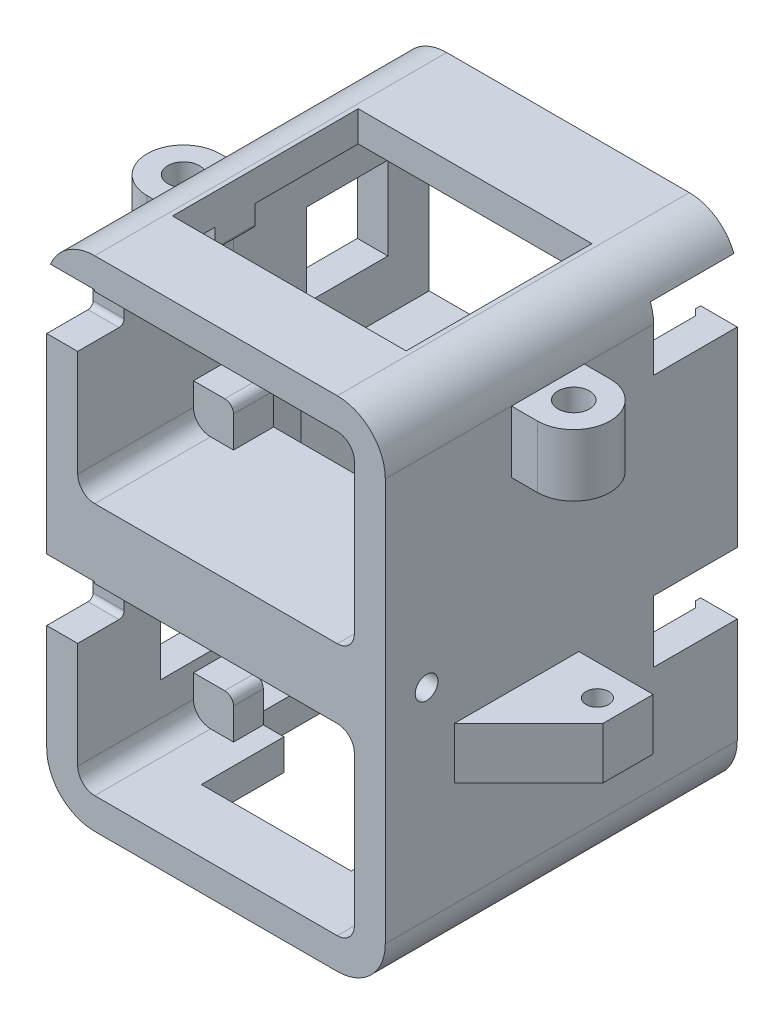
from build123d import *

# Parameters (mm, degrees)
EXTRUDE_2_DEPTH      = 11.22
EXTRUDE_3_DEPTH      = 3.88
CUT_EXTRUDE_1_DEPTH  = 4.65
SKETCH_8_R           = 3.525
SKETCH_8_R_2         = 1.525
EXTRUDE_5_DEPTH      = 6
SKETCH_9_W           = 22.64
SKETCH_9_H           = 3
CUT_EXTRUDE_3_DEPTH  = 8
SKETCH_10_W          = 21.46
SKETCH_10_H          = 6.88
CUT_EXTRUDE_4_DEPTH  = 1
SKETCH_12_R          = 1.1
CUT_EXTRUDE_5_DEPTH  = 8
CUT_EXTRUDE_START    = -8
SKETCH_13_R          = 1.1
CUT_EXTRUDE_6_DEPTH  = 8
SKETCH_14_W          = 6.52
SKETCH_14_H          = 9.68
EXTRUDE_7_DEPTH      = 3
SKETCH_15_W          = 26.9
SKETCH_15_H          = 42.4
EXTRUDE_8_DEPTH      = 19
SKETCH_16_W          = 26.9
SKETCH_16_H          = 6.6
EXTRUDE_9_DEPTH      = 16
EXTRUDE_6_DEPTH      = 5
CUT_EXTRUDE_8_REACH  = 51.73
CUT_EXTRUDE_9_REACH  = 63.439
SKETCH_18_W          = 8.1
SKETCH_18_H          = 6
CUT_EXTRUDE_START_2  = -2.95
SKETCH_19_W          = 21.46
SKETCH_19_H          = 1
SKETCH_19_H_2        = 10
CUT_EXTRUDE_10_DEPTH = 2.95
CUT_EXTRUDE_14_REACH = 65.659
SKETCH_24_W          = 14
SKETCH_24_H          = 8
CUT_EXTRUDE_11_REACH = 65.659
SKETCH_20_W          = 22.64
SKETCH_20_H          = 10
SKETCH_21_W          = 1.5
SKETCH_21_H          = 5
EXTRUDE_10_DEPTH     = 0.6
CHAMFER_1_SIZE       = 1
CUT_EXTRUDE_12_REACH = 65.933
SKETCH_22_W          = 15
SKETCH_22_H          = 9.84
SKETCH_22_W_2        = 7.1
SKETCH_22_W_3        = 7.859919518
SKETCH_22_H_2        = 8.04
CUT_EXTRUDE_13_REACH = 65.659
SKETCH_23_W          = 0.52
SKETCH_23_H          = 8


with BuildPart() as part:
    # 草图2 → 凸台-拉伸2 (new body)
    with BuildSketch(Plane.XY):
        with BuildLine():
            ThreePointArc((-16.4, -7.25), (-15.038046533, -10.538046533), (-11.75, -11.9))
            Line((-11.75, -11.9), (11.75, -11.9))
            ThreePointArc((11.75, -11.9), (15.038046533, -10.538046533), (16.4, -7.25))
            Line((16.4, -7.25), (16.4, 31.75))
            ThreePointArc((16.4, 31.75), (15.038046533, 35.038046533), (11.75, 36.4))
            Line((11.75, 36.4), (-11.75, 36.4))
            ThreePointArc((-11.75, 36.4), (-15.038046533, 35.038046533), (-16.4, 31.75))
            Line((-16.4, 31.75), (-16.4, -7.25))
        make_face()
        with BuildLine():
            Line((13.4, 7.25), (13.4, -7.25))
            ThreePointArc((13.4, -7.25), (12.916726189, -8.416726189), (11.75, -8.9))
            Line((11.75, -8.9), (-11.75, -8.9))
            ThreePointArc((-11.75, -8.9), (-12.916726189, -8.416726189), (-13.4, -7.25))
            Line((-13.4, -7.25), (-13.4, 7.25))
            ThreePointArc((-13.4, 7.25), (-12.916726189, 8.416726189), (-11.75, 8.9))
            Line((-11.75, 8.9), (11.75, 8.9))
            ThreePointArc((11.75, 8.9), (12.916726189, 8.416726189), (13.4, 7.25))
        make_face(mode=Mode.SUBTRACT)
        with BuildLine():
            Line((-11.75, 33.4), (11.75, 33.4))
            ThreePointArc((11.75, 33.4), (12.916726189, 32.916726189), (13.4, 31.75))
            Line((13.4, 31.75), (13.4, 17.25))
            ThreePointArc((13.4, 17.25), (12.916726189, 16.083273811), (11.75, 15.6))
            Line((11.75, 15.6), (-11.75, 15.6))
            ThreePointArc((-11.75, 15.6), (-12.916726189, 16.083273811), (-13.4, 17.25))
            Line((-13.4, 17.25), (-13.4, 31.75))
            ThreePointArc((-13.4, 31.75), (-12.916726189, 32.916726189), (-11.75, 33.4))
        make_face(mode=Mode.SUBTRACT)
    extrude(amount=-EXTRUDE_2_DEPTH)

    # 草图3 → 凸台-拉伸3 (add)
    with BuildSketch(Plane(origin=(0, 0, -11.22), x_dir=(-1, 0, 0), z_dir=(0, 0, -1))):
        with BuildLine():
            ThreePointArc((11.75, -11.9), (15.038046533, -10.538046533), (16.4, -7.25))
            Line((16.4, -7.25), (16.4, 31.75))
            ThreePointArc((16.4, 31.75), (15.038046533, 35.038046533), (11.75, 36.4))
            Line((11.75, 36.4), (-11.75, 36.4))
            ThreePointArc((-11.75, 36.4), (-15.038046533, 35.038046533), (-16.4, 31.75))
            Line((-16.4, 31.75), (-16.4, -7.25))
            ThreePointArc((-16.4, -7.25), (-15.038046533, -10.538046533), (-11.75, -11.9))
            Line((-11.75, -11.9), (11.75, -11.9))
        make_face()
        with BuildLine():
            Line((13.4, -5.02), (10.37, -5.02))
            ThreePointArc((10.37, -5.02), (9.768959236, -5.268959236), (9.52, -5.87))
            Line((9.52, -5.87), (9.52, -8.9))
            Line((9.52, -8.9), (-9.52, -8.9))
            Line((-9.52, -8.9), (-9.52, -5.87))
            ThreePointArc((-9.52, -5.87), (-9.768959236, -5.268959236), (-10.37, -5.02))
            Line((-10.37, -5.02), (-13.4, -5.02))
            Line((-13.4, -5.02), (-13.4, 6.82))
            Line((-13.4, 6.82), (-11.67, 6.82))
            ThreePointArc((-11.67, 6.82), (-11.422512627, 6.922512627), (-11.32, 7.17))
            Line((-11.32, 7.17), (-11.32, 8.9))
            Line((-11.32, 8.9), (11.32, 8.9))
            Line((11.32, 8.9), (11.32, 7.17))
            ThreePointArc((11.32, 7.17), (11.422512627, 6.922512627), (11.67, 6.82))
            Line((11.67, 6.82), (13.4, 6.82))
            Line((13.4, 6.82), (13.4, -5.02))
        make_face(mode=Mode.SUBTRACT)
        with BuildLine():
            Line((13.4, 31.32), (13.4, 19.48))
            Line((13.4, 19.48), (10.37, 19.48))
            ThreePointArc((10.37, 19.48), (9.768959236, 19.231040764), (9.52, 18.63))
            Line((9.52, 18.63), (9.52, 15.6))
            Line((9.52, 15.6), (-9.52, 15.6))
            Line((-9.52, 15.6), (-9.52, 18.63))
            ThreePointArc((-9.52, 18.63), (-9.768959236, 19.231040764), (-10.37, 19.48))
            Line((-10.37, 19.48), (-13.4, 19.48))
            Line((-13.4, 19.48), (-13.4, 31.32))
            Line((-13.4, 31.32), (-11.67, 31.32))
            ThreePointArc((-11.67, 31.32), (-11.422512627, 31.422512627), (-11.32, 31.67))
            Line((-11.32, 31.67), (-11.32, 33.4))
            Line((-11.32, 33.4), (11.32, 33.4))
            Line((11.32, 33.4), (11.32, 31.67))
            ThreePointArc((11.32, 31.67), (11.422512627, 31.422512627), (11.67, 31.32))
            Line((11.67, 31.32), (13.4, 31.32))
        make_face(mode=Mode.SUBTRACT)
    extrude(amount=EXTRUDE_3_DEPTH)

    # 草图4 → 切除-拉伸1 (cut)
    with BuildSketch(Plane.ZY.offset(16.4)):
        with BuildLine():
            Line((0.3, 9.05), (-4, 9.05))
            ThreePointArc((-4, 9.05), (-4.353553391, 8.903553391), (-4.5, 8.55))
            Line((-4.5, 8.55), (-4.5, 3.55))
            ThreePointArc((-4.5, 3.55), (-4.353553391, 3.196446609), (-4, 3.05))
            Line((-4, 3.05), (0.3, 3.05))
            Line((0.3, 3.05), (0.3, 9.05))
        make_face()
        with BuildLine():
            Line((0.3, 33.55), (-4, 33.55))
            ThreePointArc((-4, 33.55), (-4.353553391, 33.403553391), (-4.5, 33.05))
            Line((-4.5, 33.05), (-4.5, 28.05))
            ThreePointArc((-4.5, 28.05), (-4.353553391, 27.696446609), (-4, 27.55))
            Line((-4, 27.55), (0.3, 27.55))
            Line((0.3, 27.55), (0.3, 33.55))
        make_face()
    extrude(amount=-CUT_EXTRUDE_1_DEPTH, mode=Mode.SUBTRACT)

    # 草图8 → 凸台-拉伸5 (add)
    # profile 1 of 3: a face of its own
    with BuildSketch(Plane(origin=(0, 31.75, 0), x_dir=(1, 0, 0), z_dir=(0, 1, 0))):
        with Locations((18.9, 15.755)):
            Circle(SKETCH_8_R)
        with Locations(Location((18.9, 15.755, 0), (0, 0, 270))):
            Circle(SKETCH_8_R_2, mode=Mode.SUBTRACT)
    # profile 2 of 3: a face of its own
    with BuildSketch(Plane(origin=(0, 31.75, 0), x_dir=(1, 0, 0), z_dir=(0, 1, 0))):
        with BuildLine():
            Line((15.375, 19.28), (15.375, 15.755))
            ThreePointArc((15.375, 15.755), (16.407448596, 18.247551404), (18.9, 19.28))
            Line((18.9, 19.28), (15.375, 19.28))
        make_face()
    # profile 3 of 3: a face of its own
    with BuildSketch(Plane(origin=(0, 31.75, 0), x_dir=(1, 0, 0), z_dir=(0, 1, 0))):
        with BuildLine():
            Line((15.375, 12.23), (18.9, 12.23))
            ThreePointArc((18.9, 12.23), (16.407448596, 13.262448596), (15.375, 15.755))
            Line((15.375, 15.755), (15.375, 12.23))
        make_face()
    extrude_5 = extrude(amount=-EXTRUDE_5_DEPTH)

    # 镜向1: 凸台-拉伸5 across plane
    add(extrude_5.mirror(Plane(origin=(0, 0, 0), x_dir=(0, 0, 1), z_dir=(1, 0, 0))))

    # 草图9 → 切除-拉伸3 (cut)
    with BuildSketch(Plane(origin=(0, 0, -15.1), x_dir=(-1, 0, 0), z_dir=(0, 0, -1))):
        with Locations((0, 34.9)):
            Rectangle(SKETCH_9_W, SKETCH_9_H)
    extrude(amount=-CUT_EXTRUDE_3_DEPTH, mode=Mode.SUBTRACT)

    # 草图10 → 切除-拉伸4 (cut)
    with BuildSketch(Plane(origin=(0, 0, -15.1), x_dir=(-1, 0, 0), z_dir=(0, 0, -1))):
        with Locations((0, -8.46)):
            Rectangle(SKETCH_10_W, SKETCH_10_H)
    extrude(amount=-CUT_EXTRUDE_4_DEPTH, mode=Mode.SUBTRACT)

    # 草图12 → 切除-拉伸5 (cut)
    with BuildSketch(Plane.ZY.offset(16.4)):
        with Locations((-4, 12.25)):
            Circle(SKETCH_12_R)
    extrude(amount=-CUT_EXTRUDE_5_DEPTH, mode=Mode.SUBTRACT)

    # 草图13 → 切除-拉伸6 (cut)
    with BuildSketch(Plane(origin=(16.4, 0, 0), x_dir=(0, 0, -1), z_dir=(1, 0, 0)).offset(CUT_EXTRUDE_START)):
        with Locations(Location((4, 12.25, 0), (0, 0, 180))):
            Circle(SKETCH_13_R)
    extrude(amount=CUT_EXTRUDE_6_DEPTH, mode=Mode.SUBTRACT)

    # 草图14 → 凸台-拉伸7 (add)
    with BuildSketch(Plane(origin=(0, 0, -15.1), x_dir=(-1, 0, 0), z_dir=(0, 0, -1))):
        with Locations((-13.14, 13.79)):
            Rectangle(SKETCH_14_W, SKETCH_14_H)
        with Locations((13.14, 13.79)):
            Rectangle(SKETCH_14_W, SKETCH_14_H)
    extrude(amount=EXTRUDE_7_DEPTH)

    # 草图15 → 凸台-拉伸8 (add)
    with BuildSketch(Plane(origin=(0, 0, -15.1), x_dir=(-1, 0, 0), z_dir=(0, 0, -1))):
        with BuildLine():
            Line((-16.4, 18.63), (-16.4, 8.95))
            Line((-16.4, 8.95), (-16.4, -7.25))
            ThreePointArc((-16.4, -7.25), (-15.038046533, -10.538046533), (-11.75, -11.9))
            Line((-11.75, -11.9), (11.75, -11.9))
            ThreePointArc((11.75, -11.9), (15.038046533, -10.538046533), (16.4, -7.25))
            Line((16.4, -7.25), (16.4, 8.95))
            Line((16.4, 8.95), (16.4, 18.63))
            Line((16.4, 18.63), (16.4, 31.75))
            ThreePointArc((16.4, 31.75), (15.038046533, 35.038046533), (11.75, 36.4))
            Line((11.75, 36.4), (-11.75, 36.4))
            ThreePointArc((-11.75, 36.4), (-15.038046533, 35.038046533), (-16.4, 31.75))
            Line((-16.4, 31.75), (-16.4, 25.75))
            Line((-16.4, 25.75), (-16.4, 18.63))
        make_face()
        with Locations((0, 12.25)):
            Rectangle(SKETCH_15_W, SKETCH_15_H, mode=Mode.SUBTRACT)
    extrude(amount=EXTRUDE_8_DEPTH)

    # 草图16 → 凸台-拉伸9 (add)
    with BuildSketch(Plane(origin=(0, 0, -18.1), x_dir=(-1, 0, 0), z_dir=(0, 0, -1))):
        with Locations((0, 12.25)):
            Rectangle(SKETCH_16_W, SKETCH_16_H)
    extrude(amount=EXTRUDE_9_DEPTH)

    # 草图11 → 凸台-拉伸6 (add)
    with BuildSketch(Plane(origin=(0, 2.890336251, 0), x_dir=(1, 0, 0), z_dir=(0, 1, 0))):
        with BuildLine():
            Line((18.895757056, 18.755), (16.4, 18.755))
            Line((16.4, 18.755), (16.4, 6.716602257))
            Line((16.4, 6.716602257), (19.538397743, 9.855))
            Line((19.538397743, 9.855), (18.895757056, 9.855))
            Line((18.895757056, 9.855), (18.895757056, 15.105))
            Line((18.895757056, 15.105), (20.308345089, 15.105))
            ThreePointArc((20.308345089, 15.105), (20.095757056, 15.755), (20.308345089, 16.405))
            Line((20.308345089, 16.405), (18.895757056, 16.405))
            Line((18.895757056, 16.405), (18.895757056, 18.755))
        make_face()
        with BuildLine():
            Line((23.595757056, 18.755), (18.895757056, 18.755))
            Line((18.895757056, 18.755), (18.895757056, 16.405))
            Line((18.895757056, 16.405), (20.308345089, 16.405))
            ThreePointArc((20.308345089, 16.405), (21.537697721, 16.800503028), (22.295757056, 15.755))
            ThreePointArc((22.295757056, 15.755), (21.537697721, 14.709496972), (20.308345089, 15.105))
            Line((20.308345089, 15.105), (18.895757056, 15.105))
            Line((18.895757056, 15.105), (18.895757056, 9.855))
            Line((18.895757056, 9.855), (19.538397743, 9.855))
            Line((19.538397743, 9.855), (23.595757056, 13.912359313))
            Line((23.595757056, 13.912359313), (23.595757056, 18.755))
        make_face()
    extrude(amount=EXTRUDE_6_DEPTH)

    # 草图17 → 切除-拉伸8 (cut, up to next)
    with BuildSketch(Plane.XZ.offset(-8.95), mode=Mode.PRIVATE) as cut_extrude_8_sk1:
        Polygon((-9.88, -18.1), (0, -27.98), (9.88, -18.1), align=None)
    cut_extrude_8_tool1 = extrude(cut_extrude_8_sk1.sketch, amount=-CUT_EXTRUDE_8_REACH, mode=Mode.PRIVATE) & part.part
    add(cut_extrude_8_tool1.solids().sort_by_distance((0, 8.95, -21.393333))[0], mode=Mode.SUBTRACT)

    # 草图18 → 切除-拉伸9 (cut, up to next)
    with BuildSketch(Plane.ZY.offset(-13.45), mode=Mode.PRIVATE) as cut_extrude_9_sk1:
        with Locations((-30.05, 5.95)):
            Rectangle(SKETCH_18_W, SKETCH_18_H)
    cut_extrude_9_tool1 = extrude(cut_extrude_9_sk1.sketch, amount=-CUT_EXTRUDE_9_REACH, mode=Mode.PRIVATE) & part.part
    # 草图18 → 切除-拉伸9 (cut, up to next)
    with BuildSketch(Plane.ZY.offset(-13.45), mode=Mode.PRIVATE) as cut_extrude_9_sk2:
        with Locations((-30.05, 30.45)):
            Rectangle(SKETCH_18_W, SKETCH_18_H)
    cut_extrude_9_tool2 = extrude(cut_extrude_9_sk2.sketch, amount=-CUT_EXTRUDE_9_REACH, mode=Mode.PRIVATE) & part.part
    add(cut_extrude_9_tool1.solids().sort_by_distance((13.45, 5.95, -30.05))[0], mode=Mode.SUBTRACT)
    add(cut_extrude_9_tool2.solids().sort_by_distance((13.45, 30.45, -30.05))[0], mode=Mode.SUBTRACT)

    # 草图19 → 切除-拉伸10 (cut)
    with BuildSketch(Plane.XZ.offset(11.9).offset(CUT_EXTRUDE_START_2)):
        with Locations((0, -14.6)):
            Rectangle(SKETCH_19_W, SKETCH_19_H)
        with Locations((0, -20.1)):
            Rectangle(SKETCH_19_W, SKETCH_19_H_2)
    extrude(amount=CUT_EXTRUDE_10_DEPTH, mode=Mode.SUBTRACT)

    # 草图24 → 切除-拉伸14 (cut, up to next)
    with BuildSketch(Plane.XZ.offset(11.9), mode=Mode.PRIVATE) as cut_extrude_14_sk1:
        with Locations((0, -10.1)):
            Rectangle(SKETCH_24_W, SKETCH_24_H)
    cut_extrude_14_tool1 = extrude(cut_extrude_14_sk1.sketch, amount=-CUT_EXTRUDE_14_REACH, mode=Mode.PRIVATE) & part.part
    add(cut_extrude_14_tool1.solids().sort_by_distance((0, -11.9, -10.1))[0], mode=Mode.SUBTRACT)

    # 草图20 → 切除-拉伸11 (cut, up to next)
    with BuildSketch(Plane(origin=(0, 36.4, 0), x_dir=(1, 0, 0), z_dir=(0, 1, 0)), mode=Mode.PRIVATE) as cut_extrude_11_sk1:
        with Locations((0, 20.1)):
            Rectangle(SKETCH_20_W, SKETCH_20_H)
    cut_extrude_11_tool1 = extrude(cut_extrude_11_sk1.sketch, amount=-CUT_EXTRUDE_11_REACH, mode=Mode.PRIVATE) & part.part
    add(cut_extrude_11_tool1.solids().sort_by_distance((0, 36.4, -20.1))[0], mode=Mode.SUBTRACT)

    # 草图21 → 凸台-拉伸10 (add)
    with BuildSketch(Plane.ZY.offset(-13.45)):
        with Locations((-33.35, 24.95)):
            Rectangle(SKETCH_21_W, SKETCH_21_H)
        with Locations((-33.35, 0.45)):
            Rectangle(SKETCH_21_W, SKETCH_21_H)
    extrude(amount=EXTRUDE_10_DEPTH)

    # 倒角1
    # the kernel refuses this chamfer: 1 mm, written as the material it takes off along each edge
    with BuildSketch(Plane(origin=(12.85, 5.521682988, -32.6), x_dir=(-0.02749587661058555, 0, -0.9996219169112968), z_dir=(0, -1, 0))) as chamfer_1_piece_1_section:
        Polygon((CHAMFER_1_SIZE * 0.999621916911, CHAMFER_1_SIZE * 0.0274958766106), (-CHAMFER_1_SIZE * 0.0274958766106, CHAMFER_1_SIZE * 0.999621916911), (0, 0), align=None)
    chamfer_1_piece_1 = extrude(amount=10.143365976, mode=Mode.PRIVATE)
    chamfer_1_piece_1 = split(chamfer_1_piece_1, bisect_by=Plane(origin=(13.45, 0.45, -32.97500946), z_dir=(-1, 0, 0)), keep=Keep.TOP, mode=Mode.PRIVATE)
    add(chamfer_1_piece_1, mode=Mode.SUBTRACT)
    with BuildSketch(Plane(origin=(12.85, 30.021682988, -32.6), x_dir=(-0.02749587661058555, 0, -0.9996219169112968), z_dir=(0, -1, 0))) as chamfer_1_piece_2_section:
        Polygon((CHAMFER_1_SIZE * 0.999621916911, CHAMFER_1_SIZE * 0.0274958766106), (-CHAMFER_1_SIZE * 0.0274958766106, CHAMFER_1_SIZE * 0.999621916911), (0, 0), align=None)
    chamfer_1_piece_2 = extrude(amount=10.143365976, mode=Mode.PRIVATE)
    chamfer_1_piece_2 = split(chamfer_1_piece_2, bisect_by=Plane(origin=(13.45, 24.95, -32.97500946), z_dir=(-1, 0, 0)), keep=Keep.TOP, mode=Mode.PRIVATE)
    add(chamfer_1_piece_2, mode=Mode.SUBTRACT)

    # 草图22 → 切除-拉伸12 (cut, up to next)
    with BuildSketch(Plane.ZY.offset(16.4), mode=Mode.PRIVATE) as cut_extrude_12_sk1:
        with Locations((-22.6, 0.9)):
            Rectangle(SKETCH_22_W, SKETCH_22_H)
    cut_extrude_12_tool1 = extrude(cut_extrude_12_sk1.sketch, amount=-CUT_EXTRUDE_12_REACH, mode=Mode.PRIVATE) & part.part
    # 草图22 → 切除-拉伸12 (cut, up to next)
    with BuildSketch(Plane.ZY.offset(16.4), mode=Mode.PRIVATE) as cut_extrude_12_sk2:
        with Locations((-11.55, 0.9)):
            Rectangle(SKETCH_22_W_2, SKETCH_22_H)
    cut_extrude_12_tool2 = extrude(cut_extrude_12_sk2.sketch, amount=-CUT_EXTRUDE_12_REACH, mode=Mode.PRIVATE) & part.part
    # 草图22 → 切除-拉伸12 (cut, up to next)
    with BuildSketch(Plane.ZY.offset(16.4), mode=Mode.PRIVATE) as cut_extrude_12_sk3:
        with Locations((-26.170040241, 24.5)):
            Rectangle(SKETCH_22_W_3, SKETCH_22_H_2)
    cut_extrude_12_tool3 = extrude(cut_extrude_12_sk3.sketch, amount=-CUT_EXTRUDE_12_REACH, mode=Mode.PRIVATE) & part.part
    add(cut_extrude_12_tool1.solids().sort_by_distance((-16.4, 0.9, -22.6))[0], mode=Mode.SUBTRACT)
    add(cut_extrude_12_tool2.solids().sort_by_distance((-16.4, 0.9, -11.55))[0], mode=Mode.SUBTRACT)
    add(cut_extrude_12_tool3.solids().sort_by_distance((-16.4, 24.5, -26.17004))[0], mode=Mode.SUBTRACT)

    # 草图23 → 切除-拉伸13 (cut, up to next)
    with BuildSketch(Plane.XZ.offset(11.9), mode=Mode.PRIVATE) as cut_extrude_13_sk1:
        with Locations((-7.26, -10.1)):
            Rectangle(SKETCH_23_W, SKETCH_23_H)
    cut_extrude_13_tool1 = extrude(cut_extrude_13_sk1.sketch, amount=-CUT_EXTRUDE_13_REACH, mode=Mode.PRIVATE) & part.part
    add(cut_extrude_13_tool1.solids().sort_by_distance((-7.26, -11.9, -10.1))[0], mode=Mode.SUBTRACT)


solid = part.part
